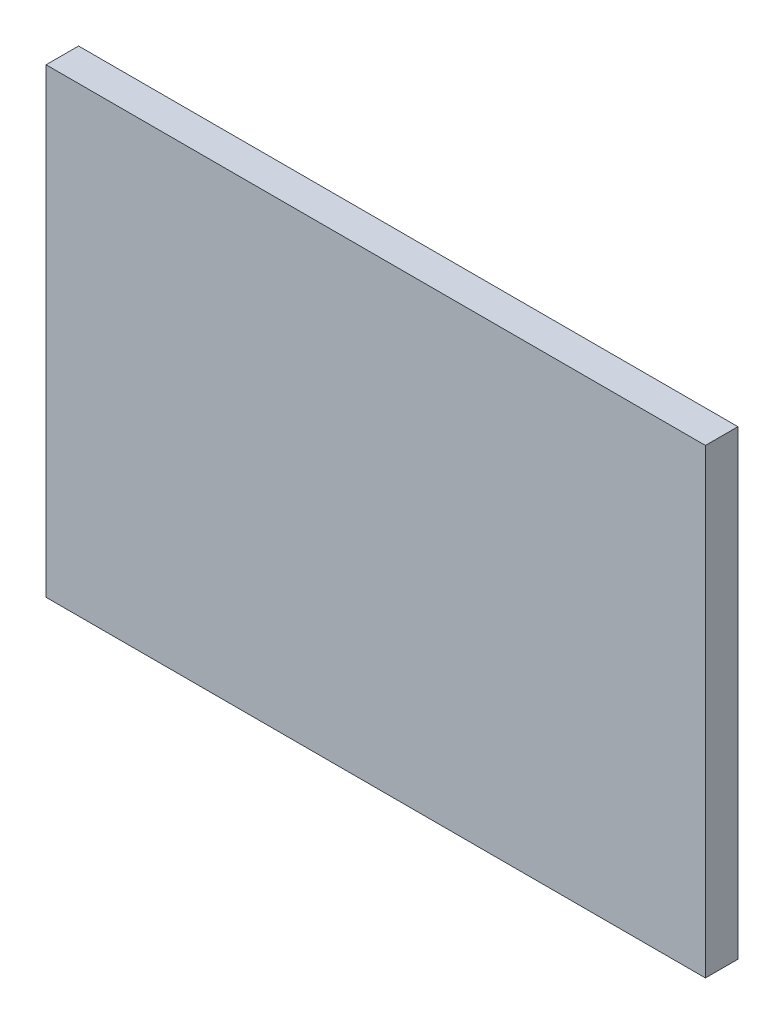
from build123d import *

# Parameters (mm, degrees)
SKETCH1_W           = 203
SKETCH1_H           = 142
BOSS_EXTRUDE1_DEPTH = 5


with BuildPart() as part:
    # Sketch1 → Boss-Extrude1 (new, symmetric)
    with BuildSketch(Plane.XY):
        Rectangle(SKETCH1_W, SKETCH1_H)
    extrude(amount=BOSS_EXTRUDE1_DEPTH, both=True)


solid = part.part
